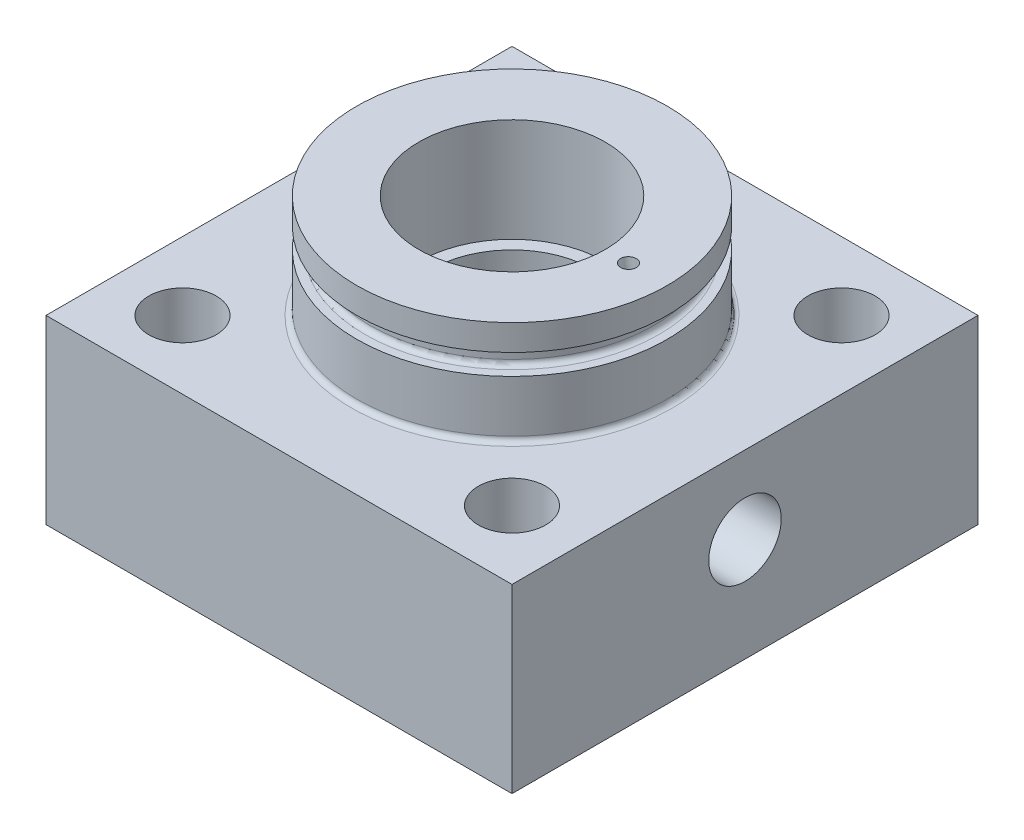
from build123d import *

# Parameters (mm, degrees)
SKETCH1_W                  = 90
SKETCH1_H                  = 90
EXTRUDE1_DEPTH             = 35
SKETCH2_R                  = 30
EXTRUDE2_DEPTH             = 20
SKETCH5_W                  = 6.681632653
SKETCH5_H                  = 4
SKETCH6_R                  = 6.5
CUT_EXTRUDE1_DEPTH         = 85.113019206
MIRROR2_COPY_1_SKETCH_R    = 6.5
MIRROR2_COPY_1_DEPTH       = 85.113019206
M16X2_0_TAPPED_HOLE1_D     = 14
M16X2_0_TAPPED_HOLE1_DEPTH = 18
M16X2_0_TAPPED_HOLE1_TIP   = 4.206024333
FILLET1_R                  = 1
CUT_SWEEP1_START           = -49.987863257
CUT_SWEEP1_OUTLINE_R       = 1.5
CUT_SWEEP1_DEPTH           = 29.274008659


# Read off the part's stored shape, not the designer's step: Cut-Sweep1
with BuildPart() as part:
    # Sketch1 → Extrude1 (new body)
    with BuildSketch(Plane(origin=(0, 0, 0), x_dir=(1, 0, 0), z_dir=(0, 1, 0))):
        Rectangle(SKETCH1_W, SKETCH1_H)
    extrude(amount=EXTRUDE1_DEPTH)

    # Sketch2 → Extrude2 (add)
    with BuildSketch(Plane(origin=(0, 35, 0), x_dir=(-1, 0, 0), z_dir=(0, 1, 0))):
        with Locations(Location((0, 0, 0), (0, 0, 270))):
            Circle(SKETCH2_R)
    extrude(amount=EXTRUDE2_DEPTH)

    # Sketch3 → Cut-Revolve1 (revolve, cut)
    with BuildSketch(Plane.XY, mode=Mode.PRIVATE) as cut_revolve1_sk:
        Polygon((0, 0), (-23, 0), (-23, 9), (-24.25, 9), (-24.25, 12), (-21, 12), (-21, 26), (-15.5, 26), (-15.5, 35), (-18, 35), (-18, 55), (0, 55), align=None)
    revolve(cut_revolve1_sk.sketch.rotate(Axis((0, 0, 0), (0, 1, 0)), 270), axis=Axis((0, 0, 0), (0, 1, 0)), mode=Mode.SUBTRACT)

    # Sketch5 → Cut-Revolve2 (revolve, cut)
    with BuildSketch(Plane.XY, mode=Mode.PRIVATE) as cut_revolve2_sk:
        with Locations((-30.740816327, 48)):
            Rectangle(SKETCH5_W, SKETCH5_H)
    revolve(cut_revolve2_sk.sketch.rotate(Axis((0, 0, 0), (0, 1, 0)), 270), axis=Axis((0, 0, 0), (0, 1, 0)), mode=Mode.SUBTRACT)

    # Sketch6 → Cut-Extrude1 (cut, through all)
    with BuildSketch(Plane.XZ):
        with Locations(Location((31.819805153, -31.819805153, 0), (0, 0, 270))):
            Circle(SKETCH6_R)
    cut_extrude1 = extrude(amount=-CUT_EXTRUDE1_DEPTH, mode=Mode.SUBTRACT)

    # Mirror1: Cut-Extrude1 across plane
    add(cut_extrude1.mirror(Plane.XY), mode=Mode.SUBTRACT)

    # Mirror2: Cut-Extrude1 across plane
    add(cut_extrude1.mirror(Plane(origin=(0, 0, 0), x_dir=(0, 0, 1), z_dir=(1, 0, 0))), mode=Mode.SUBTRACT)

    # Mirror2 copy 1 sketch → Mirror2 copy 1 (cut, through all)
    with BuildSketch(Plane(origin=(0, 0, 0), x_dir=(-1, 0, 0), z_dir=(0, -1, 0))):
        with Locations(Location((31.819805153, -31.819805153, 0), (0, 0, 270))):
            Circle(MIRROR2_COPY_1_SKETCH_R)
    extrude(amount=-MIRROR2_COPY_1_DEPTH, mode=Mode.SUBTRACT)

    # M16x2.0 Tapped Hole1
    with Locations(Plane(origin=(45, 0, 0), x_dir=(0, 0, -1), z_dir=(1, 0, 0))):
        with Locations((0, 20)):
            Hole(M16X2_0_TAPPED_HOLE1_D / 2, depth=M16X2_0_TAPPED_HOLE1_DEPTH)
            with Locations((0, 0, -(M16X2_0_TAPPED_HOLE1_DEPTH + M16X2_0_TAPPED_HOLE1_TIP / 2))):  # 118° drill point
                Cone(0, M16X2_0_TAPPED_HOLE1_D / 2, M16X2_0_TAPPED_HOLE1_TIP, mode=Mode.SUBTRACT)

    # Fillet1
    fillet1_edges = [part.edges().sort_by_distance(p)[0] for p in [
        (0, 35, 30),
        (0, 50, 27.4),
        (0, 46, 27.4),
    ]]
    fillet(fillet1_edges, radius=FILLET1_R)

    # Cut-Sweep1 outline → Cut-Sweep1 (cut)
    with BuildSketch(Plane(origin=(0, 0, 0), x_dir=(0.981627183447665, 0.19080899537653903, 0), z_dir=(0.19080899537653903, -0.9816271834476651, 0)).offset(CUT_SWEEP1_START)):
        with Locations((32.581106373, 0)):
            Circle(CUT_SWEEP1_OUTLINE_R)
    extrude(amount=CUT_SWEEP1_DEPTH, mode=Mode.SUBTRACT)


solid = part.part
